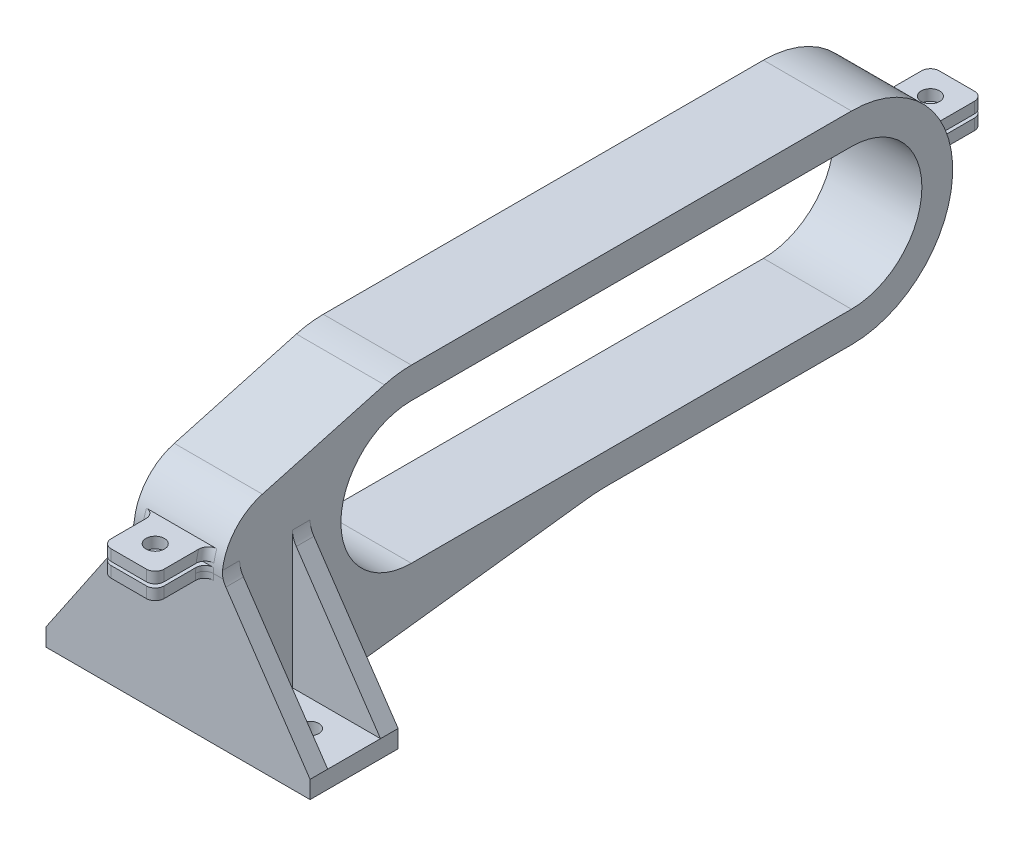
from build123d import *

# Parameters (mm, degrees)
SKETCH1_W           = 76.2
SKETCH1_H           = 25.4
SKETCH1_R           = 2.54
BOSS_EXTRUDE1_DEPTH = 5.08
BOSS_EXTRUDE2_START = -25.4
BOSS_EXTRUDE2_DEPTH = 25.4
FILLET1_R           = 50.8
BOSS_EXTRUDE3_DEPTH = 5.08
BOSS_EXTRUDE4_DEPTH = 5.08
FILLET2_R           = 6.35
BOSS_EXTRUDE5_START = -5.08
BOSS_EXTRUDE5_DEPTH = 15.24
SKETCH6_R           = 2.667
CUT_EXTRUDE1_DEPTH  = 12.7
FILLET3_R           = 2.54


with BuildPart() as part:
    # Sketch1 → Boss-Extrude1 (new body)
    with BuildSketch(Plane(origin=(0, 0, 0), x_dir=(1, 0, 0), z_dir=(0, 1, 0))):
        with Locations((38.1, 12.7)):
            Rectangle(SKETCH1_W, SKETCH1_H)
        with Locations((12.7, 12.7)):
            Circle(SKETCH1_R, mode=Mode.SUBTRACT)
        with Locations((63.5, 12.7)):
            Circle(SKETCH1_R, mode=Mode.SUBTRACT)
        with Locations((38.1, 12.7)):
            Circle(SKETCH1_R, mode=Mode.SUBTRACT)
    extrude(amount=BOSS_EXTRUDE1_DEPTH)

    # Sketch2 → Boss-Extrude2 (add)
    with BuildSketch(Plane(origin=(76.2, 0, 0), x_dir=(0, 0, -1), z_dir=(1, 0, 0)).offset(BOSS_EXTRUDE2_START)):
        with BuildLine():
            Line((181.61, 68.58), (54.61, 68.58))
            ThreePointArc((54.61, 68.58), (50.69392644, 68.316303181), (46.848558539, 67.529973836))
            Line((46.848558539, 67.529973836), (11.624232842, 57.821458356))
            ThreePointArc((11.624232842, 57.821458356), (3.237005791, 52.152067047), (0, 42.559915623))
            Line((0, 42.559915623), (0, 5.08))
            Line((0, 5.08), (25.4, 5.08))
            Line((25.4, 5.08), (25.4, 0))
            Line((25.4, 0), (108.146559708, 10.16))
            Line((108.146559708, 10.16), (181.61, 10.16))
            ThreePointArc((181.61, 10.16), (210.82, 39.37), (181.61, 68.58))
        make_face()
        with BuildLine():
            ThreePointArc((54.61, 19.05), (34.29, 39.37), (54.61, 59.69))
            Line((54.61, 59.69), (181.61, 59.69))
            ThreePointArc((181.61, 59.69), (201.93, 39.37), (181.61, 19.05))
            Line((181.61, 19.05), (54.61, 19.05))
        make_face(mode=Mode.SUBTRACT)
    extrude(amount=-BOSS_EXTRUDE2_DEPTH)

    # Fillet1
    fillet1_edges = [part.edges().sort_by_distance(p)[0] for p in [
        (38.1, 10.16, -108.146559708),
    ]]
    fillet(fillet1_edges, radius=FILLET1_R)

    # Sketch3 → Boss-Extrude3 (add)
    with BuildSketch(Plane.XY):
        Polygon((50.8, 42.559915623), (76.2, 5.08), (50.8, 5.08), align=None)
        Polygon((25.4, 42.559915623), (25.4, 5.08), (0, 5.08), align=None)
    extrude(amount=-BOSS_EXTRUDE3_DEPTH)

    # Sketch4 → Boss-Extrude4 (add)
    with BuildSketch(Plane(origin=(0, 0, -25.4), x_dir=(-1, 0, 0), z_dir=(0, 0, -1))):
        Polygon((-76.2, 5.08), (-50.8, 42.559915623), (-50.8, 5.08), align=None)
        Polygon((0, 5.08), (-25.4, 42.559915623), (-25.4, 5.08), align=None)
    extrude(amount=-BOSS_EXTRUDE4_DEPTH)

    # Fillet2
    fillet2_edges = [part.edges().sort_by_distance(p)[0] for p in [
        (25.4, 42.559915623, -2.54),
    ]]
    fillet(fillet2_edges, radius=FILLET2_R)
    fillet2_2_edges = [part.edges().sort_by_distance(p)[0] for p in [
        (25.4, 42.559915623, -22.86),
    ]]
    fillet(fillet2_2_edges, radius=FILLET2_R)
    fillet2_3_edges = [part.edges().sort_by_distance(p)[0] for p in [
        (50.8, 42.559915623, -22.86),
    ]]
    fillet(fillet2_3_edges, radius=FILLET2_R)
    fillet2_4_edges = [part.edges().sort_by_distance(p)[0] for p in [
        (50.8, 42.559915623, -2.54),
    ]]
    fillet(fillet2_4_edges, radius=FILLET2_R)

    # Sketch5 → Boss-Extrude5 (add)
    with BuildSketch(Plane(origin=(50.8, 0, 0), x_dir=(0, 0, -1), z_dir=(1, 0, 0)).offset(BOSS_EXTRUDE5_START)):
        with BuildLine():
            Line((-14.204285573, 45.016903308), (0.191830449, 45.016903308))
            ThreePointArc((0.191830449, 45.016903308), (0.531188408, 46.626353337), (1.035714427, 48.191903308))
            Line((1.035714427, 48.191903308), (-14.204285573, 48.191903308))
            Line((-14.204285573, 48.191903308), (-14.204285573, 45.016903308))
        make_face()
        with BuildLine():
            Line((-14.204285573, 40.825903308), (0, 40.825903308))
            Line((0, 40.825903308), (0, 42.559915623))
            ThreePointArc((0, 42.559915623), (0.016438446, 43.281158401), (0.065719644, 44.000903308))
            Line((0.065719644, 44.000903308), (-14.204285573, 44.000903308))
            Line((-14.204285573, 44.000903308), (-14.204285573, 40.825903308))
        make_face()
        with BuildLine():
            Line((209.455971379, 48.191903308), (224.695971379, 48.191903308))
            Line((224.695971379, 48.191903308), (224.695971379, 45.016903308))
            Line((224.695971379, 45.016903308), (210.268970376, 45.016903308))
            ThreePointArc((210.268970376, 45.016903308), (209.907036363, 46.615814866), (209.455971379, 48.191903308))
        make_face()
        with BuildLine():
            Line((210.450576183, 44.000903308), (224.695971379, 44.000903308))
            Line((224.695971379, 44.000903308), (224.695971379, 40.825903308))
            Line((224.695971379, 40.825903308), (210.78369441, 40.825903308))
            ThreePointArc((210.78369441, 40.825903308), (210.660543099, 42.417957617), (210.450576183, 44.000903308))
        make_face()
    extrude(amount=-BOSS_EXTRUDE5_DEPTH)

    # Sketch6 → Cut-Extrude1 (cut)
    with BuildSketch(Plane(origin=(0, 48.191903308, 0), x_dir=(1, 0, 0), z_dir=(0, 1, 0))):
        with Locations((38.1, -6.584285573)):
            Circle(SKETCH6_R)
        with Locations((38.1, 217.075971379)):
            Circle(SKETCH6_R)
    extrude(amount=-CUT_EXTRUDE1_DEPTH, mode=Mode.SUBTRACT)

    # Fillet3
    fillet3_edges = [part.edges().sort_by_distance(p)[0] for p in [
        (30.48, 41.692909466, 0),
        (45.72, 41.692909466, 0),
        (30.48, 42.413403308, -224.695971379),
        (30.48, 42.417957617, -210.660543099),
        (45.72, 42.417957617, -210.660543099),
        (45.72, 42.413403308, -224.695971379),
        (30.48, 46.604403308, -224.695971379),
        (30.48, 46.615814866, -209.907036363),
        (45.72, 46.615814866, -209.907036363),
        (45.72, 46.604403308, -224.695971379),
        (30.48, 42.413403308, 14.204285573),
        (30.48, 43.281158401, -0.016438446),
        (45.72, 43.281158401, -0.016438446),
        (45.72, 42.413403308, 14.204285573),
        (30.48, 46.604403308, 14.204285573),
        (30.48, 46.626353337, -0.531188408),
        (45.72, 46.626353337, -0.531188408),
        (45.72, 46.604403308, 14.204285573),
    ]]
    fillet(fillet3_edges, radius=FILLET3_R)


solid = part.part
